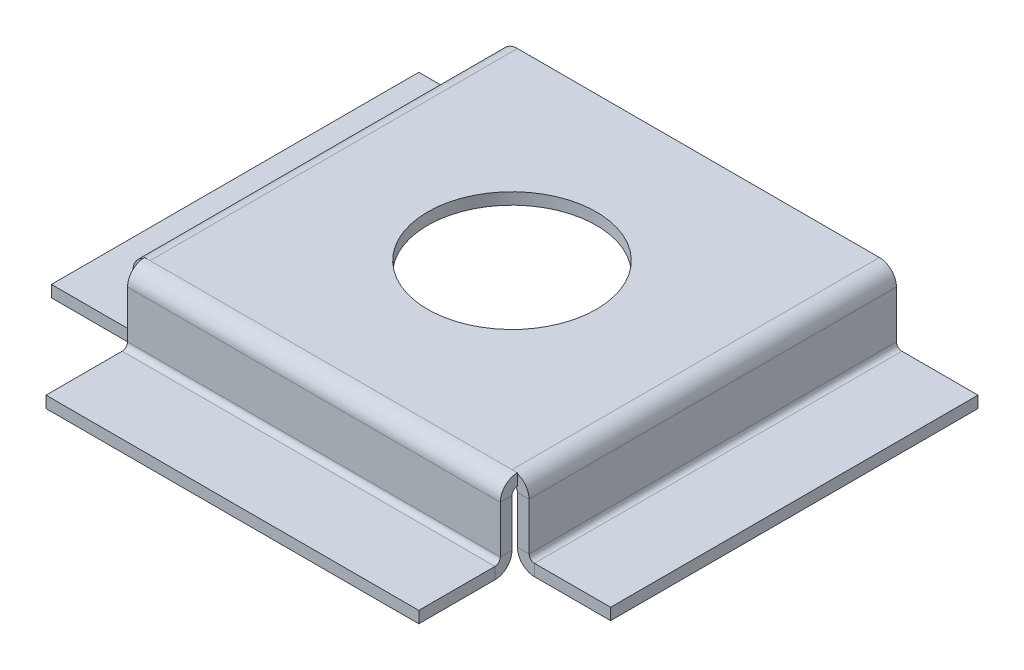
from build123d import *

# Parameters (mm, degrees)
SKETCH6_W                      = 50.8
SKETCH6_H                      = 1.5875
BASE_FLANGE1_DEPTH             = 50.8
EDGE_FLANGE1_STRIP_W           = 7.8232
EDGE_FLANGE1_STRIP_H           = 1.5875
EDGE_FLANGE1_STRIP_CUT_DEPTH   = 50.8
EDGE_FLANGE1_DEPTH             = 50.8
SKETCH16_R                     = 11.5
CUT_EXTRUDE1_DEPTH             = 74.592226364
EDGE_FLANGE4_STRIP_W           = 7.8232
EDGE_FLANGE4_STRIP_H           = 1.5875
EDGE_FLANGE4_STRIP_CUT_DEPTH   = 50.0634
EDGE_FLANGE4_STRIP_2_W         = 7.8232
EDGE_FLANGE4_STRIP_2_H         = 1.5875
EDGE_FLANGE4_STRIP_CUT_2_DEPTH = 50.0634
EDGE_FLANGE4_DEPTH             = 50.0634
EDGE_FLANGE4_BEND_DEPTH        = 50.0634
EDGE_FLANGE5_STRIP_W           = 7.8232
EDGE_FLANGE5_STRIP_H           = 1.5875
EDGE_FLANGE5_STRIP_CUT_DEPTH   = 50.0634
EDGE_FLANGE5_STRIP_2_W         = 7.8232
EDGE_FLANGE5_STRIP_2_H         = 1.5875
EDGE_FLANGE5_STRIP_CUT_2_DEPTH = 50.0634
EDGE_FLANGE5_DEPTH             = 50.0634
EDGE_FLANGE5_BEND_DEPTH        = 50.0634
EDGE_FLANGE6_STRIP_W           = 7.8232
EDGE_FLANGE6_STRIP_H           = 1.5875
EDGE_FLANGE6_STRIP_CUT_DEPTH   = 50.8
EDGE_FLANGE6_DEPTH             = 50.8


# Sheet-metal steps are written as plain solids
with BuildPart() as part:
    # Sketch6 → Base-Flange1 (new body)
    with BuildSketch(Plane.XY):
        with Locations((-25.4, 0.79375)):
            Rectangle(SKETCH6_W, SKETCH6_H)
    extrude(amount=BASE_FLANGE1_DEPTH)

    # Edge-Flange1 strip (across the edge) → Edge-Flange1 strip cut (cut)
    with BuildSketch(Plane(origin=(0, 0, 50.8), x_dir=(0, 0, -1), z_dir=(-1, 0, 0))):
        with Locations((-3.175, -0.79375)):
            Rectangle(EDGE_FLANGE1_STRIP_W, EDGE_FLANGE1_STRIP_H)
    extrude(amount=EDGE_FLANGE1_STRIP_CUT_DEPTH, mode=Mode.SUBTRACT)

    # Edge-Flange1 section (across the edge) → Edge-Flange1 (add)
    with BuildSketch(Plane(origin=(0, 0, 50.8), x_dir=(0, 0, -1), z_dir=(-1, 0, 0))):
        with BuildLine():
            Line((-1.5875, 0.7366), (-1.5875, 7.9375))
            Line((-1.5875, 7.9375), (0, 7.9375))
            Line((0, 7.9375), (0, 0.7366))
            ThreePointArc((0, 0.7366), (0.215745145, 0.215745145), (0.7366, 0))
            Line((0.7366, 0), (0.7366, -1.5875))
            ThreePointArc((0.7366, -1.5875), (-0.90678687, -0.90678687), (-1.5875, 0.7366))
        make_face()
    extrude(amount=EDGE_FLANGE1_DEPTH)

    # Sketch16 → Cut-Extrude1 (cut, through all)
    with BuildSketch(Plane(origin=(0, 1.5875, 0), x_dir=(1, 0, 0), z_dir=(0, 1, 0))):
        with Locations(Location((-25.4, -25.4, 0), (0, 0, 180))):
            Circle(SKETCH16_R)
    extrude(amount=-CUT_EXTRUDE1_DEPTH, mode=Mode.SUBTRACT)

    # Edge-Flange4 strip (across the edge) → Edge-Flange4 strip cut (cut)
    with BuildSketch(Plane(origin=(0, 0, 0), x_dir=(-1, 0, 0), z_dir=(0, 0, 1))):
        with Locations((-3.175, -0.79375)):
            Rectangle(EDGE_FLANGE4_STRIP_W, EDGE_FLANGE4_STRIP_H)
    extrude(amount=EDGE_FLANGE4_STRIP_CUT_DEPTH, mode=Mode.SUBTRACT)

    # Edge-Flange4 strip 2 (across the edge) → Edge-Flange4 strip cut 2 (cut)
    with BuildSketch(Plane(origin=(-50.8, 0, 50.0634), x_dir=(1, 0, 0), z_dir=(0, 0, -1))):
        with Locations((-3.175, -0.79375)):
            Rectangle(EDGE_FLANGE4_STRIP_2_W, EDGE_FLANGE4_STRIP_2_H)
    extrude(amount=EDGE_FLANGE4_STRIP_CUT_2_DEPTH, mode=Mode.SUBTRACT)

    # Edge-Flange4 section (across the edge) → Edge-Flange4 (add)
    with BuildSketch(Plane(origin=(0, 0, 0), x_dir=(-1, 0, 0), z_dir=(0, 0, 1))):
        with BuildLine():
            Line((-1.5875, 0.7366), (-1.5875, 7.9375))
            Line((-1.5875, 7.9375), (0, 7.9375))
            Line((0, 7.9375), (0, 0.7366))
            ThreePointArc((0, 0.7366), (0.215745145, 0.215745145), (0.7366, 0))
            Line((0.7366, 0), (0.7366, -1.5875))
            ThreePointArc((0.7366, -1.5875), (-0.90678687, -0.90678687), (-1.5875, 0.7366))
        make_face()
    extrude(amount=EDGE_FLANGE4_DEPTH)

    # Edge-Flange4 section 2 (across the edge) → Edge-Flange4 bend (add)
    with BuildSketch(Plane(origin=(-50.8, 0, 50.0634), x_dir=(1, 0, 0), z_dir=(0, 0, -1))):
        with BuildLine():
            Line((-1.5875, 0.7366), (-1.5875, 7.9375))
            Line((-1.5875, 7.9375), (0, 7.9375))
            Line((0, 7.9375), (0, 0.7366))
            ThreePointArc((0, 0.7366), (0.215745145, 0.215745145), (0.7366, 0))
            Line((0.7366, 0), (0.7366, -1.5875))
            ThreePointArc((0.7366, -1.5875), (-0.90678687, -0.90678687), (-1.5875, 0.7366))
        make_face()
    extrude(amount=EDGE_FLANGE4_BEND_DEPTH)

    # Edge-Flange5 strip (across the edge) → Edge-Flange5 strip cut (cut)
    with BuildSketch(Plane(origin=(1.5875, -7.9375, 50.0634), x_dir=(0, 1, 0), z_dir=(0, 0, -1))):
        with Locations((-3.175, -0.79375)):
            Rectangle(EDGE_FLANGE5_STRIP_W, EDGE_FLANGE5_STRIP_H)
    extrude(amount=EDGE_FLANGE5_STRIP_CUT_DEPTH, mode=Mode.SUBTRACT)

    # Edge-Flange5 strip 2 (across the edge) → Edge-Flange5 strip cut 2 (cut)
    with BuildSketch(Plane(origin=(-52.3875, -7.9375, 0), x_dir=(0, 1, 0), z_dir=(0, 0, 1))):
        with Locations((-3.175, -0.79375)):
            Rectangle(EDGE_FLANGE5_STRIP_2_W, EDGE_FLANGE5_STRIP_2_H)
    extrude(amount=EDGE_FLANGE5_STRIP_CUT_2_DEPTH, mode=Mode.SUBTRACT)

    # Edge-Flange5 section (across the edge) → Edge-Flange5 (add)
    with BuildSketch(Plane(origin=(1.5875, -7.9375, 50.0634), x_dir=(0, 1, 0), z_dir=(0, 0, -1))):
        with BuildLine():
            Line((-1.5875, 0.7366), (-1.5875, 11.1125))
            Line((-1.5875, 11.1125), (0, 11.1125))
            Line((0, 11.1125), (0, 0.7366))
            ThreePointArc((0, 0.7366), (0.215745145, 0.215745145), (0.7366, 0))
            Line((0.7366, 0), (0.7366, -1.5875))
            ThreePointArc((0.7366, -1.5875), (-0.90678687, -0.90678687), (-1.5875, 0.7366))
        make_face()
    extrude(amount=EDGE_FLANGE5_DEPTH)

    # Edge-Flange5 section 2 (across the edge) → Edge-Flange5 bend (add)
    with BuildSketch(Plane(origin=(-52.3875, -7.9375, 0), x_dir=(0, 1, 0), z_dir=(0, 0, 1))):
        with BuildLine():
            Line((-1.5875, 0.7366), (-1.5875, 11.1125))
            Line((-1.5875, 11.1125), (0, 11.1125))
            Line((0, 11.1125), (0, 0.7366))
            ThreePointArc((0, 0.7366), (0.215745145, 0.215745145), (0.7366, 0))
            Line((0.7366, 0), (0.7366, -1.5875))
            ThreePointArc((0.7366, -1.5875), (-0.90678687, -0.90678687), (-1.5875, 0.7366))
        make_face()
    extrude(amount=EDGE_FLANGE5_BEND_DEPTH)

    # Edge-Flange6 strip (across the edge) → Edge-Flange6 strip cut (cut)
    with BuildSketch(Plane(origin=(-50.8, -7.9375, 52.3875), x_dir=(0, 1, 0), z_dir=(1, 0, 0))):
        with Locations((-3.175, -0.79375)):
            Rectangle(EDGE_FLANGE6_STRIP_W, EDGE_FLANGE6_STRIP_H)
    extrude(amount=EDGE_FLANGE6_STRIP_CUT_DEPTH, mode=Mode.SUBTRACT)

    # Edge-Flange6 section (across the edge) → Edge-Flange6 (add)
    with BuildSketch(Plane(origin=(-50.8, -7.9375, 52.3875), x_dir=(0, 1, 0), z_dir=(1, 0, 0))):
        with BuildLine():
            Line((-1.5875, 0.7366), (-1.5875, 11.1125))
            Line((-1.5875, 11.1125), (0, 11.1125))
            Line((0, 11.1125), (0, 0.7366))
            ThreePointArc((0, 0.7366), (0.215745145, 0.215745145), (0.7366, 0))
            Line((0.7366, 0), (0.7366, -1.5875))
            ThreePointArc((0.7366, -1.5875), (-0.90678687, -0.90678687), (-1.5875, 0.7366))
        make_face()
    extrude(amount=EDGE_FLANGE6_DEPTH)


solid = part.part
